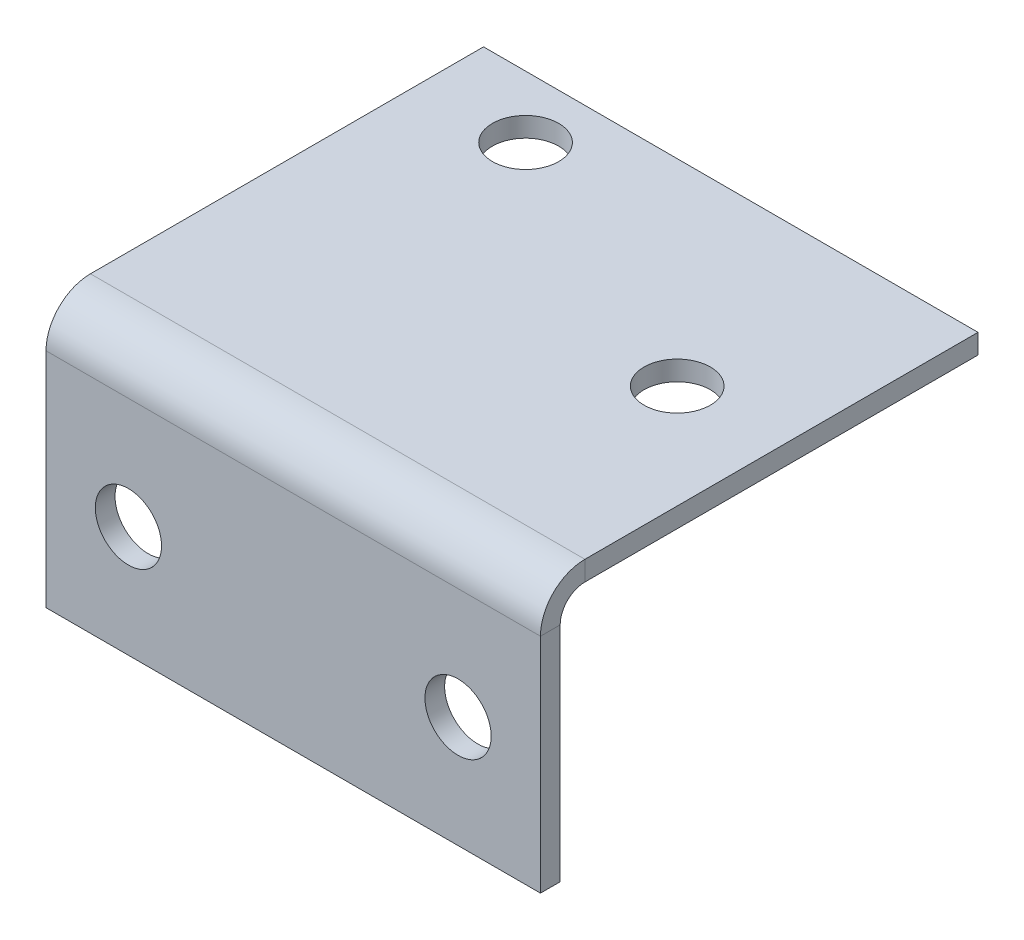
from build123d import *

# Parameters (mm, degrees)
SKETCH7_W                    = 38.1
SKETCH7_H                    = 19.05
BASE_FLANGE1_DEPTH           = 1.51892
EDGE_FLANGE1_STRIP_W         = 9.88568
EDGE_FLANGE1_STRIP_H         = 1.51892
EDGE_FLANGE1_STRIP_CUT_DEPTH = 38.1
EDGE_FLANGE1_DEPTH           = 38.1
F_10_CLEARANCE_HOLE1_D       = 5.1054
F_10_CLEARANCE_HOLE2_D       = 5.1054
SKETCH24_W                   = 38.1
SKETCH24_H                   = 12.2555
CUT_EXTRUDE1_DEPTH           = 54.281766168


# Sheet-metal steps are written as plain solids
with BuildPart() as part:
    # Sketch7 → Base-Flange1 (new body)
    with BuildSketch(Plane.XY):
        Rectangle(SKETCH7_W, SKETCH7_H)
    extrude(amount=-BASE_FLANGE1_DEPTH)

    # Edge-Flange1 strip (across the edge) → Edge-Flange1 strip cut (cut)
    with BuildSketch(Plane(origin=(-19.05, 9.525, -1.51892), x_dir=(0, -1, 0), z_dir=(1, 0, 0))):
        with Locations((-3.03784, -0.75946)):
            Rectangle(EDGE_FLANGE1_STRIP_W, EDGE_FLANGE1_STRIP_H)
    extrude(amount=EDGE_FLANGE1_STRIP_CUT_DEPTH, mode=Mode.SUBTRACT)

    # Edge-Flange1 section (across the edge) → Edge-Flange1 (add)
    with BuildSketch(Plane(origin=(-19.05, 9.525, -1.51892), x_dir=(0, -1, 0), z_dir=(1, 0, 0))):
        with BuildLine():
            Line((-1.51892, 1.905), (-1.51892, 44.45))
            Line((-1.51892, 44.45), (0, 44.45))
            Line((0, 44.45), (0, 1.905))
            ThreePointArc((0, 1.905), (0.557961582, 0.557961582), (1.905, 0))
            Line((1.905, 0), (1.905, -1.51892))
            ThreePointArc((1.905, -1.51892), (-0.51607705, -0.51607705), (-1.51892, 1.905))
        make_face()
    extrude(amount=EDGE_FLANGE1_DEPTH)

    # #10 Clearance Hole1 (through all)
    with Locations(Plane.XY):
        with Locations((-12.7, -0.9525), (12.7, -0.9525)):
            Hole(F_10_CLEARANCE_HOLE1_D / 2)

    # #10 Clearance Hole2 (through all)
    with Locations(Plane(origin=(0, 9.525, 0), x_dir=(-1, 0, 0), z_dir=(0, -1, 0))):
        with Locations((-11.049, 18.53692), (11.049, 28.95092)):
            Hole(F_10_CLEARANCE_HOLE2_D / 2)

    # Sketch24 → Cut-Extrude1 (cut, through all)
    with BuildSketch(Plane.XZ.offset(-9.525)):
        with Locations((0, -39.84117)):
            Rectangle(SKETCH24_W, SKETCH24_H)
    extrude(amount=-CUT_EXTRUDE1_DEPTH, mode=Mode.SUBTRACT)


solid = part.part
